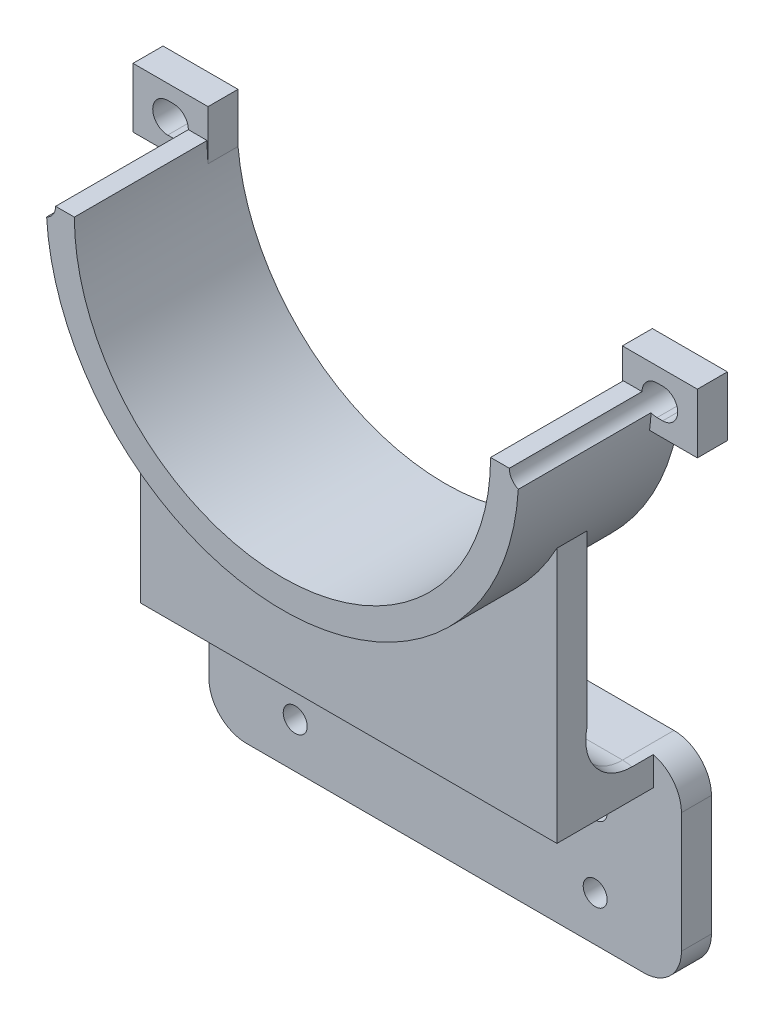
from build123d import *

# Parameters (mm, degrees)
BOSS_EXTRU_1_DEPTH           = 10.85
BOSS_EXTRU_1_DEPTH_BACK      = 10.85
BOSS_EXTRU_2_START           = -10.85
ESQUISSE2_W                  = 10
ESQUISSE2_H                  = 7.943097622
BOSS_EXTRU_2_DEPTH           = 4
ESQUISSE3_R                  = 2
ENL_V_MAT_EXTRU_1_DEPTH      = 51.255478557
R_P_TITION_CIRCULAIRE1_COUNT = 2
BOSS_EXTRU_3_DEPTH           = 2
BOSS_EXTRU_3_DEPTH_BACK      = 2
ESQUISSE5_W                  = 55.5
ESQUISSE5_H                  = 16.85
BOSS_EXTRU_4_DEPTH           = 4
CONG_1_R                     = 6
ESQUISSE6_W                  = 63
ESQUISSE6_H                  = 26
BOSS_EXTRU_5_DEPTH           = 4
ESQUISSE7_R                  = 1.6
ENL_V_MAT_EXTRU_2_DEPTH      = 10
CONG_2_START                 = -16
CONG_2_DEPTH                 = 7.9999999


with BuildPart() as part:
    # Esquisse1 → Boss.-Extru.1 (new, two sides: drawn at the far end of the back side and taken through both)
    with BuildSketch(Plane.XY.offset(-BOSS_EXTRU_1_DEPTH_BACK)):
        with BuildLine():
            Line((31.5, 0), (27.75, 0))
            ThreePointArc((27.75, 0), (0, -27.75), (-27.75, 0))
            Line((-27.75, 0), (-31.5, 0))
            ThreePointArc((-31.5, 0), (0, -31.5), (31.5, 0))
        make_face()
    extrude(amount=BOSS_EXTRU_1_DEPTH + BOSS_EXTRU_1_DEPTH_BACK)

    # Esquisse2 → Boss.-Extru.2 (add)
    with BuildSketch(Plane.XY.offset(BOSS_EXTRU_2_START)):
        with Locations((-32.625, 0)):
            Rectangle(ESQUISSE2_W, ESQUISSE2_H)
        with BuildLine():
            ThreePointArc((-33, -2), (-35, 0), (-33, 2))
            Line((-33, 2), (-32.25, 2))
            ThreePointArc((-32.25, 2), (-30.835786438, 1.414213562), (-30.25, 0))
            ThreePointArc((-30.25, 0), (-30.835786438, -1.414213562), (-32.25, -2))
            Line((-32.25, -2), (-33, -2))
        make_face(mode=Mode.SUBTRACT)
    boss_extru_2 = extrude(amount=BOSS_EXTRU_2_DEPTH)

    # Esquisse3 → Enlèv. mat.-Extru.1 (cut, symmetric)
    with BuildSketch(Plane.XY):
        with Locations((-32.25, 0)):
            Circle(ESQUISSE3_R)
    enl_v_mat_extru_1 = extrude(amount=ENL_V_MAT_EXTRU_1_DEPTH, both=True, mode=Mode.SUBTRACT)

    # Répétition circulaire1: Boss.-Extru.2, Enlèv. mat.-Extru.1 ×2 about axis
    r_p_tition_circulaire1_axis = Axis((0, 0, 0), (0, 0, 1))
    add([boss_extru_2.rotate(r_p_tition_circulaire1_axis, i * 360 / R_P_TITION_CIRCULAIRE1_COUNT) for i in range(1, R_P_TITION_CIRCULAIRE1_COUNT)])
    add([enl_v_mat_extru_1.rotate(r_p_tition_circulaire1_axis, i * 360 / R_P_TITION_CIRCULAIRE1_COUNT) for i in range(1, R_P_TITION_CIRCULAIRE1_COUNT)], mode=Mode.SUBTRACT)

    # Esquisse4 → Boss.-Extru.3 (add, two sides: drawn at the far end of the back side and taken through both)
    with BuildSketch(Plane.XY.offset(-BOSS_EXTRU_3_DEPTH_BACK)):
        with BuildLine():
            Line((27.75, -45), (27.75, -3.971548811))
            Line((27.75, -3.971548811), (27.464327773, -3.971548811))
            ThreePointArc((27.464327773, -3.971548811), (0, -27.75), (-27.464327773, -3.971548811))
            Line((-27.464327773, -3.971548811), (-27.75, -3.971548811))
            Line((-27.75, -3.971548811), (-27.75, -45))
            Line((-27.75, -45), (27.75, -45))
        make_face()
    extrude(amount=BOSS_EXTRU_3_DEPTH + BOSS_EXTRU_3_DEPTH_BACK)

    # Esquisse5 → Boss.-Extru.4 (add)
    with BuildSketch(Plane.XZ.offset(45)):
        with Locations((0, -6.425)):
            Rectangle(ESQUISSE5_W, ESQUISSE5_H)
    extrude(amount=BOSS_EXTRU_4_DEPTH)

    # Congé1
    cong_1_edges = [part.edges().sort_by_distance(p)[0] for p in [
        (0, -45, -2),
    ]]
    fillet(cong_1_edges, radius=CONG_1_R)

    # Esquisse6 → Boss.-Extru.5 (add)
    with BuildSketch(Plane(origin=(0, 0, -14.85), x_dir=(-1, 0, 0), z_dir=(0, 0, -1))):
        with Locations((0, -58)):
            Rectangle(ESQUISSE6_W, ESQUISSE6_H)
    extrude(amount=-BOSS_EXTRU_5_DEPTH)

    # Esquisse7 → Enlèv. mat.-Extru.2 (cut)
    with BuildSketch(Plane(origin=(0, 0, -14.85), x_dir=(-1, 0, 0), z_dir=(0, 0, -1))):
        with Locations((-20, -55)):
            Circle(ESQUISSE7_R)
        with Locations((20, -55)):
            Circle(ESQUISSE7_R)
        with Locations((-20, -65)):
            Circle(ESQUISSE7_R)
        with Locations((20, -65)):
            Circle(ESQUISSE7_R)
    extrude(amount=-ENL_V_MAT_EXTRU_2_DEPTH, mode=Mode.SUBTRACT)

    # Congé2: read off the stored shape, not the designer's step
    # Congé2 outline → Congé2 (cut)
    with BuildSketch(Plane.XY.offset(CONG_2_START)):
        with BuildLine():
            Line((-31.5, -71), (-26.5, -71))
            ThreePointArc((-26.5, -71), (-30.035533906, -69.535533906), (-31.5, -66))
            Line((-31.5, -66), (-31.5, -71))
        make_face()
        with BuildLine():
            ThreePointArc((31.5, -66), (30.035533906, -69.535533906), (26.5, -71))
            Line((26.5, -71), (31.5, -71))
            Line((31.5, -71), (31.5, -66))
        make_face()
        with BuildLine():
            Line((-31.5, -45), (-31.5, -50))
            ThreePointArc((-31.5, -50), (-30.035533906, -46.464466094), (-26.5, -45))
            Line((-26.5, -45), (-31.5, -45))
        make_face()
        with BuildLine():
            Line((31.5, -50), (31.5, -45))
            Line((31.5, -45), (26.5, -45))
            ThreePointArc((26.5, -45), (30.035533906, -46.464466094), (31.5, -50))
        make_face()
    extrude(amount=CONG_2_DEPTH, mode=Mode.SUBTRACT)

    # Cong_2 2 outline → Cong_2 2 (revolve, cut)
    with BuildSketch(Plane(origin=(0, -39, -8), x_dir=(0, 1, 0), z_dir=(0, 0, -1))):
        with BuildLine():
            Line((6, -27.75), (6.158770817, -27.75))
            ThreePointArc((6.158770817, -27.75), (6.039851519, -27.130021462), (6, -26.5))
            Line((6, -26.5), (6, -27.75))
        make_face()
        with BuildLine():
            Line((6, 27.75), (6, 26.5))
            ThreePointArc((6, 26.5), (6.039851519, 27.130021462), (6.158770817, 27.75))
            Line((6.158770817, 27.75), (6, 27.75))
        make_face()
    revolve(axis=Axis((0, -39, -8), (1, 0, 0)), mode=Mode.SUBTRACT)


solid = part.part
